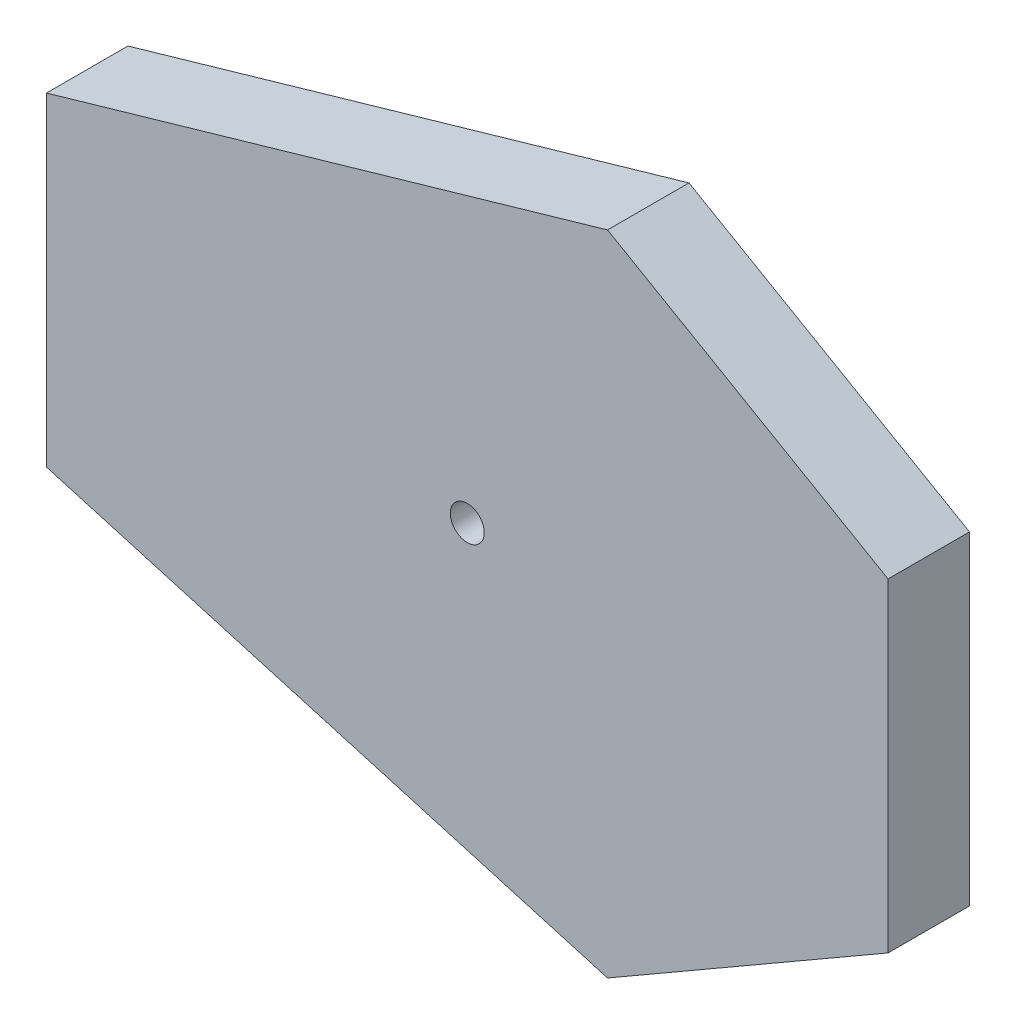
from build123d import *

# Parameters (mm, degrees)
SKETCH1_R           = 1.25
BOSS_EXTRUDE1_DEPTH = 6
SKETCH2_R           = 2.1
CUT_EXTRUDE1_DEPTH  = 3


with BuildPart() as part:
    # Sketch1 → Boss-Extrude1 (new body)
    with BuildSketch(Plane.XY):
        Polygon((-36.15, 11.931905563), (-36.15, -11.931905563), (5.183333333, -23.863811127), (25.85, -11.931905563), (25.85, 11.931905563), (5.183333333, 23.863811127), align=None)
        with Locations((-5.15, 0)):
            Circle(SKETCH1_R, mode=Mode.SUBTRACT)
    extrude(amount=BOSS_EXTRUDE1_DEPTH)

    # Sketch2 → Cut-Extrude1 (cut)
    with BuildSketch(Plane(origin=(0, 0, 0), x_dir=(-1, 0, 0), z_dir=(0, 0, -1))):
        with Locations((5.15, 0)):
            Circle(SKETCH2_R)
    extrude(amount=-CUT_EXTRUDE1_DEPTH, mode=Mode.SUBTRACT)


solid = part.part
